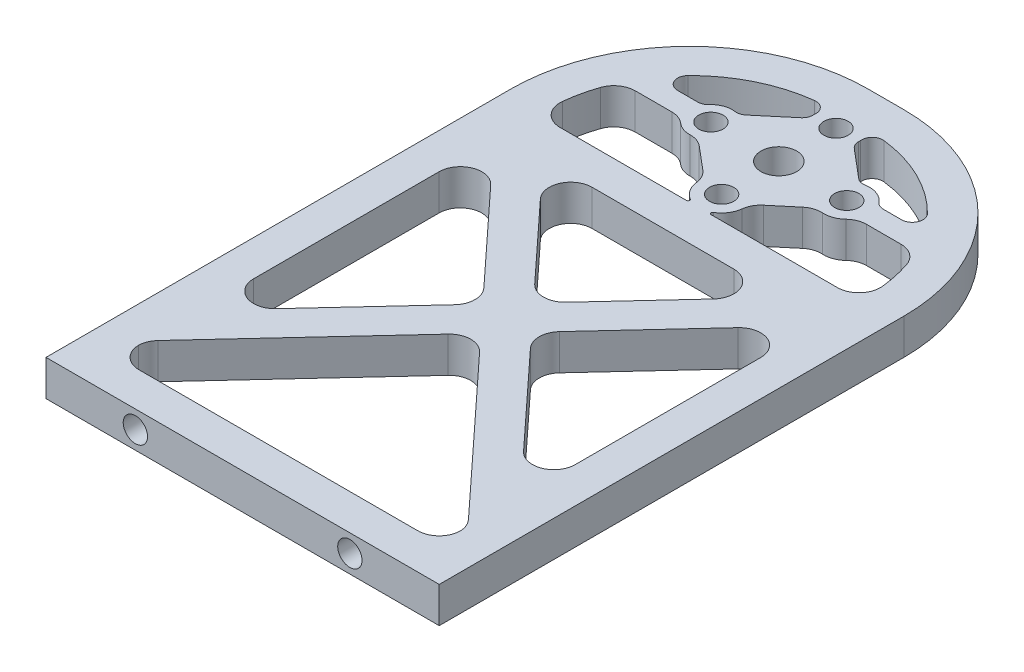
from build123d import *

# Parameters (mm, degrees)
SKETCH1_W           = 55.00000000000001
SKETCH1_H           = 90
BOSS_EXTRUDE1_DEPTH = 5
SKETCH2_R           = 2.499999999999999
SKETCH2_R_2         = 1.7000000000000015
CUT_EXTRUDE1_DEPTH  = 5
CUT_EXTRUDE2_DEPTH  = 5
SKETCH4_R           = 1.6999999999999995
CUT_EXTRUDE3_DEPTH  = 10
FILLET1_R           = 25
CUT_EXTRUDE4_DEPTH  = 5
FILLET2_R           = 3
FILLET3_R           = 1.5
FILLET4_DEPTH       = 5
FILLET5_DEPTH       = 5


with BuildPart() as part:
    # Sketch1 → Boss-Extrude1 (new body)
    with BuildSketch(Plane(origin=(0, 0, 0), x_dir=(1, 0, 0), z_dir=(0, 1, 0))):
        with Locations((27.500000000000004, 45)):
            Rectangle(SKETCH1_W, SKETCH1_H)
    extrude(amount=BOSS_EXTRUDE1_DEPTH)

    # Sketch2 → Cut-Extrude1 (cut)
    with BuildSketch(Plane(origin=(0, 5, 0), x_dir=(1, 0, 0), z_dir=(0, 1, 0))):
        with Locations(Location((27.5, 75, 0), (0, 0, 270))):
            Circle(SKETCH2_R)
        with Locations(Location((27.5, 83, 0), (0, 0, 270))):
            Circle(SKETCH2_R_2)
        with Locations(Location((27.5, 66.99999999999999, 0), (0, 0, 270))):
            Circle(SKETCH2_R_2)
        with Locations(Location((18.000000000000004, 75, 0), (0, 0, 270))):
            Circle(SKETCH2_R_2)
        with Locations(Location((37, 75, 0), (0, 0, 270))):
            Circle(SKETCH2_R_2)
    extrude(amount=-CUT_EXTRUDE1_DEPTH, mode=Mode.SUBTRACT)

    # Sketch3 → Cut-Extrude2 (cut)
    with BuildSketch(Plane(origin=(0, 5, 0), x_dir=(1, 0, 0), z_dir=(0, 1, 0))):
        with BuildLine():
            Line((10.000000000000012, 10), (15.00000000000001, 10.000000000000002))
            ThreePointArc((15.00000000000001, 10.000000000000002), (17.50000000000001, 7.500000000000004), (15.000000000000012, 5.000000000000005))
            Line((15.000000000000012, 5.000000000000005), (10.000000000000012, 5.000000000000004))
            ThreePointArc((10.000000000000012, 5.000000000000004), (7.500000000000015, 7.500000000000003), (10.000000000000012, 10))
        make_face()
        with BuildLine():
            Line((44.999999999999986, 10.000000000000055), (39.99999999999999, 10.000000000000057))
            ThreePointArc((39.99999999999999, 10.000000000000057), (37.499999999999986, 7.500000000000061), (39.999999999999986, 5.00000000000006))
            Line((39.999999999999986, 5.00000000000006), (44.999999999999986, 5.00000000000006))
            ThreePointArc((44.999999999999986, 5.00000000000006), (47.499999999999986, 7.500000000000058), (44.999999999999986, 10.000000000000055))
        make_face()
    extrude(amount=-CUT_EXTRUDE2_DEPTH, mode=Mode.SUBTRACT)

    # Sketch4 → Cut-Extrude3 (cut)
    with BuildSketch(Plane.XY):
        with Locations((12.5, 2.5)):
            Circle(SKETCH4_R)
        with Locations((42.49999999999999, 2.5)):
            Circle(SKETCH4_R)
    extrude(amount=-CUT_EXTRUDE3_DEPTH, mode=Mode.SUBTRACT)

    # Fillet1
    fillet1_edges = [part.edges().sort_by_distance(p)[0] for p in [
        (0, 2.5, -90),
        (55, 2.5, -90),
    ]]
    fillet(fillet1_edges, radius=FILLET1_R)

    # Sketch5 → Cut-Extrude4 (cut)
    with BuildSketch(Plane(origin=(0, 5, 0), x_dir=(1, 0, 0), z_dir=(0, 1, 0))):
        with BuildLine():
            ThreePointArc((30.000000000000004, 84.99999999999999), (30.616351748042604, 83.73372459579312), (30.629699199450542, 82.32547578178497))
            Line((30.629699199450524, 82.32547578178496), (35.80270803789781, 77.9692578125662))
            ThreePointArc((35.802708037897816, 77.96925781256621), (38.09764753434343, 78.00751889276688), (39.82842712474622, 76.49999999999993))
            Line((39.82842712474624, 76.49999999999999), (46.363068171954, 76.49999999999999))
            ThreePointArc((46.363068171953856, 76.49999999999959), (39.21954445729311, 82.74823934929873), (30.000000000000004, 84.99999999999999))
        make_face()
        with BuildLine():
            Line((19.021093968951536, 77.82088055517613), (24.370300800549494, 82.32547578178495))
            ThreePointArc((24.37030080054947, 82.32547578178496), (24.383648251957403, 83.7337245957931), (25.000000000000004, 84.99999999999999))
            ThreePointArc((25, 84.99999999999999), (15.780455542706903, 82.74823934929873), (8.636931828046162, 76.49999999999959))
            Line((8.63693182804602, 76.49999999999999), (15.40192378864667, 76.49999999999999))
            ThreePointArc((15.40192378864667, 76.49999999999997), (16.971457532003043, 77.81817323660678), (19.021093968951533, 77.82088055517613))
        make_face()
        with BuildLine():
            ThreePointArc((50, 64.99999999999997), (49.52021183036496, 69.35446094226141), (48.10386699023197, 73.49999999999936))
            Line((48.103866990232184, 73.50000000000001), (39.82842712474624, 73.50000000000001))
            ThreePointArc((39.82842712474622, 73.50000000000007), (38.09764753434344, 71.99248110723312), (35.80270803789783, 72.03074218743379))
            Line((35.80270803789782, 72.0307421874338), (30.629699199450528, 67.67452421821504))
            ThreePointArc((30.629699199450535, 67.67452421821503), (30.402791018509024, 65.64951701126475), (28.99999999999998, 64.1715728752538))
            Line((29.000000000000004, 64.17157287525379), (29.000000000000004, 63.79843788128356))
            Line((29.000000000000004, 63.79843788128356), (50, 63.79843788128356))
            Line((50, 63.79843788128356), (50, 64.99999999999997))
        make_face()
        with BuildLine():
            ThreePointArc((19.021093968951497, 72.17911944482385), (16.971457532003026, 72.18182676339323), (15.40192378864667, 73.50000000000003))
            Line((15.40192378864667, 73.50000000000001), (6.89613300976783, 73.50000000000001))
            ThreePointArc((6.89613300976804, 73.49999999999936), (5.479788169635057, 69.35446094226141), (5.000000000000007, 64.99999999999997))
            Line((5.000000000000004, 64.99999999999997), (5.000000000000004, 63.79843788128356))
            Line((5.000000000000004, 63.79843788128356), (26.000000000000004, 63.79843788128356))
            Line((26.000000000000004, 63.79843788128356), (26.000000000000004, 64.17157287525377))
            ThreePointArc((26.00000000000005, 64.17157287525379), (24.59720898149099, 65.64951701126472), (24.37030080054947, 67.67452421821501))
            Line((24.37030080054949, 67.67452421821503), (19.0210939689515, 72.17911944482385))
        make_face()
        Polygon((27.50000000000002, 40.67879140383743), (44.277961342029805, 58.798437881283576), (10.722038657970216, 58.79843788128357), align=None)
        Polygon((50, 16.37953135480838), (50, 57.61882430970066), (30.907153353376447, 36.999177832254524), align=None)
        Polygon((24.09284664662358, 36.999177832254496), (5.000000000000021, 57.61882430970065), (5.000000000000001, 16.379531354808364), align=None)
        Polygon((50, 5), (50, 9.020304211642536), (27.500000000000004, 33.3195642606716), (5.000000000000028, 9.020304211642582), (5, 5), align=None)
    extrude(amount=-CUT_EXTRUDE4_DEPTH, mode=Mode.SUBTRACT)

    # Fillet2
    # the kernel refuses this fillet: 3 mm, written as the material it adds along each edge
    with BuildSketch(Plane(origin=(30.62969919945053, 5, -67.67452421821503), x_dir=(0.7649111981170442, 0, -0.6441357457827876), z_dir=(0, -1, 0))) as fillet2_piece_1:
        with BuildLine():
            CenterArc((1.4388170342279112, 3), FILLET2_R, 226.52075102631792, 43.47924897368284)
            ThreePointArc((-0.6254584228035264, 0.823129117862604), (-0.2792858227831543, 0.43697667064582524), (0, 0))
            Line((0, 0), (1.4388170342279505, 4e-17))
        make_face()
    extrude(amount=5)
    with BuildSketch(Plane(origin=(35.80270803789783, 5, -72.03074218743379), x_dir=(0.9756512801214835, 0, 0.21932756232929423), z_dir=(0, -1, 0))) as fillet2_piece_2:
        with BuildLine():
            CenterArc((1.5181554182088943, 2.960641583195651), FILLET2_R, 217.22955187796006, 43.47924897368256)
            Line((-0.8704985020702118, 1.1456119831242833), (0, 0))
            ThreePointArc((0, 0), (0.5168993575467952, 0.04200280543114734), (1.0337987150935795, 0))
        make_face()
    extrude(amount=5)
    with BuildSketch(Plane(origin=(39.82842712474623, 5, -73.50000000000004), x_dir=(1, 0, 1.975e-14), z_dir=(0, -1, 0))) as fillet2_piece_3:
        with BuildLine():
            CenterArc((1.4388170342279547, 3), FILLET2_R, 226.5207510263163, 43.47924897368256)
            ThreePointArc((-0.6254584228035449, 0.8231291178626615), (-0.27928582278316433, 0.43697667064583906), (0, 0))
            Line((0, 0), (1.4388170342278954, 0))
        make_face()
    extrude(amount=5)
    with BuildSketch(Plane(origin=(48.10386699023208, 5, -73.49999999999969), x_dir=(-1, 0, -1.6195e-13), z_dir=(0, -1, 0))) as fillet2_piece_4:
        with BuildLine():
            CenterArc((2.018159048086173, -3), FILLET2_R, 89.99999999999072, 71.12349636944082)
            ThreePointArc((-0.8204952946452142, -2.0294117647054244), (-0.4380333665326992, -1.0034720596920297), (0, 0))
            Line((0, 0), (2.018159048086659, 0))
        make_face()
    extrude(amount=5)
    with BuildSketch(Plane(origin=(50, 5, -63.79843788128356), x_dir=(-1, 0, 0), z_dir=(0, -1, 0))) as fillet2_piece_5:
        with BuildLine():
            CenterArc((3.0953964498671382, 3), FILLET2_R, 173.9272895495291, 96.07271045047094)
            Line((0.11223111749075088, 3.317371390814756), (-0.18608541574688786, 3.3491085298962275))
            ThreePointArc((-0.18608541574688786, 3.3491085298962275), (-0.29999999999999716, 1.20156211871641), (-0.29999999999999716, 0))
            Line((-0.29999999999999716, 0), (0, -0.29999999999999716))
            Line((0, -0.29999999999999716), (3.0953964498671382, -0.29999999999999716))
            Line((3.0953964498671382, -0.29999999999999716), (3.0953964498671382, 0))
        make_face()
    extrude(amount=5)
    with BuildSketch(Plane(origin=(24.37030080054948, 5, -67.67452421821503), x_dir=(-0.76491119811705, 0, -0.6441357457827805), z_dir=(0, -1, 0))) as fillet2_piece_6:
        with BuildLine():
            CenterArc((1.4388170342279347, -3.0000000000000018), FILLET2_R, 89.99999999999983, 43.47924897368253)
            ThreePointArc((-0.6254584228035133, -0.8231291178626141), (-0.27928582278314756, -0.43697667064583), (0, 0))
            Line((0, 0), (1.4388170342279438, -1e-17))
        make_face()
    extrude(amount=5)
    with BuildSketch(Plane(origin=(19.021093968951497, 5, -72.17911944482385), x_dir=(0.7649111981170513, 0, 0.644135745782779), z_dir=(0, -1, 0))) as fillet2_piece_7:
        with BuildLine():
            CenterArc((1.3705507552437566, 3.0000000000000018), FILLET2_R, 228.59037789072798, 41.409622109271936)
            ThreePointArc((-0.6137627280547322, 0.7500000000000423), (-0.27639603776938276, 0.39994767601300885), (0, 0))
            Line((0, 0), (1.3705507552437535, -3e-17))
        make_face()
    extrude(amount=5)
    with BuildSketch(Plane(origin=(15.401923788646672, 5, -73.50000000000003), x_dir=(0.6333158920043296, 0, 0.7738933911946531), z_dir=(0, -1, 0))) as fillet2_piece_8:
        with BuildLine():
            CenterArc((1.4536885994895705, 2.96060784779286), FILLET2_R, 219.29518894536204, 41.409622109273414)
            Line((-0.8679915740944324, 1.0606601717799247), (0, 0))
            ThreePointArc((0, 0), (0.4845628664965213, 0.03939215220713661), (0.9691257329930376, -6e-17))
        make_face()
    extrude(amount=5)
    with BuildSketch(Plane(origin=(6.896133009767933, 5, -73.49999999999969), x_dir=(1, 0, -1.6195e-13), z_dir=(0, -1, 0))) as fillet2_piece_9:
        with BuildLine():
            CenterArc((2.0181590480861766, 3), FILLET2_R, 198.87650363056818, 71.12349636944111)
            ThreePointArc((-0.8204952946452142, 2.0294117647054386), (-0.43803336653269564, 1.0034720596920155), (0, 0))
            Line((0, 0), (2.0181590480866625, 0))
        make_face()
    extrude(amount=5)
    with BuildSketch(Plane(origin=(5.000000000000004, 5, -63.79843788128356), x_dir=(0.03381199502885917, 0, -0.9994282110247681), z_dir=(0, -1, 0))) as fillet2_piece_10:
        with BuildLine():
            CenterArc((3.1029461624495607, 2.9921905512165696), FILLET2_R, 178.06234606412994, 96.0727104504706)
            Line((0.10466152937525638, 3.0936265363031437), (-0.1951669339321712, 3.103770134811801))
            Line((-0.1951669339321712, 3.103770134811801), (-0.2998284633074276, 0.01014359850865765))
            Line((-0.2998284633074276, 0.01014359850865765), (-0.01014359850865774, -0.29982846330743024))
            ThreePointArc((-0.01014359850865774, -0.29982846330743024), (1.190731480235214, -0.3404556756923323), (3.340901627409787, -0.299219055121657))
            Line((3.340901627409787, -0.299219055121657), (3.3192693124134056, 0))
        make_face()
    extrude(amount=5)
    with BuildSketch(Plane(origin=(50, 5, -5), x_dir=(0, 0, -1), z_dir=(0, -1, 0))) as fillet2_piece_11:
        with BuildLine():
            CenterArc((FILLET2_R, -FILLET2_R), FILLET2_R, 90, 90)
            Line((0, -FILLET2_R), (0, 0))
            Line((0, 0), (FILLET2_R, 0))
        make_face()
    extrude(amount=5)
    with BuildSketch(Plane(origin=(50, 5, -9.020304211642536), x_dir=(0, 0, 1), z_dir=(0, -1, 0))) as fillet2_piece_12:
        with BuildLine():
            CenterArc((FILLET2_R * 0.391878315343, FILLET2_R), FILLET2_R, 227.20172837753046, 42.79827162246954)
            Line((-FILLET2_R * 0.287540855003, FILLET2_R * 0.266249639887), (0, 0))
            Line((0, 0), (FILLET2_R * 0.391878315343, 0))
        make_face()
    extrude(amount=5)
    with BuildSketch(Plane(origin=(5, 5, -5), x_dir=(0, 0, -1), z_dir=(0, -1, 0))) as fillet2_piece_13:
        with BuildLine():
            CenterArc((FILLET2_R, FILLET2_R), FILLET2_R, 180, 90)
            Line((0, FILLET2_R), (0, 0))
            Line((0, 0), (FILLET2_R, 0))
        make_face()
    extrude(amount=5)
    with BuildSketch(Plane(origin=(5.000000000000014, 5, -9.020304211642575), x_dir=(0.6794191703463476, 0, -0.7337503601129478), z_dir=(0, -1, 0))) as fillet2_piece_14:
        with BuildLine():
            CenterArc((FILLET2_R * 0.391878315343, FILLET2_R), FILLET2_R, 227.20172837753026, 42.798271622469485)
            Line((-FILLET2_R * 0.287540855003, FILLET2_R * 0.266249639887), (0, 0))
            Line((0, 0), (FILLET2_R * 0.391878315343, -2e-17))
        make_face()
    extrude(amount=5)
    with BuildSketch(Plane(origin=(27.500000000000007, 5, -33.319564260671605), x_dir=(0.6794191703463425, 0, 0.7337503601129526), z_dir=(0, -1, 0))) as fillet2_piece_15:
        with BuildLine():
            CenterArc((FILLET2_R * 1.07996711329, FILLET2_R), FILLET2_R, 175.59654324493897, 94.40345675506092)
            Line((FILLET2_R * 0.0829189914716, FILLET2_R * 1.07677918193), (0, 0))
            Line((0, 0), (FILLET2_R * 1.07996711329, -2e-17))
        make_face()
    extrude(amount=5)
    with BuildSketch(Plane(origin=(5.000000000000011, 5, -16.379531354808368), x_dir=(-1.16e-15, 0, -1), z_dir=(0, -1, 0))) as fillet2_piece_16:
        with BuildLine():
            CenterArc((FILLET2_R * 2.55181254192, FILLET2_R), FILLET2_R, 132.79827162246937, 137.20172837753069)
            Line((FILLET2_R * 1.87239337158, FILLET2_R * 1.73375036011), (0, 0))
            Line((0, 0), (FILLET2_R * 2.55181254192, 0))
        make_face()
    extrude(amount=5)
    with BuildSketch(Plane(origin=(50, 5, -16.37953135480838), x_dir=(0, 0, -1), z_dir=(0, -1, 0))) as fillet2_piece_17:
        with BuildLine():
            CenterArc((FILLET2_R * 2.55181254192, -FILLET2_R), FILLET2_R, 90, 137.20172837753046)
            Line((FILLET2_R * 1.87239337158, -FILLET2_R * 1.73375036011), (0, 0))
            Line((0, 0), (FILLET2_R * 2.55181254192, 0))
        make_face()
    extrude(amount=5)
    with BuildSketch(Plane(origin=(30.907153353376444, 5, -36.99917783225452), x_dir=(0.6794191703463437, 0, -0.7337503601129515), z_dir=(0, -1, 0))) as fillet2_piece_18:
        with BuildLine():
            CenterArc((FILLET2_R * 0.925954121838, FILLET2_R), FILLET2_R, 184.40345675506106, 85.59654324493908)
            Line((-FILLET2_R * 0.071093999981, FILLET2_R * 0.923220818068), (0, 0))
            Line((0, 0), (FILLET2_R * 0.925954121838, 4e-17))
        make_face()
    extrude(amount=5)
    with BuildSketch(Plane(origin=(50, 5, -57.61882430970066), x_dir=(0, 0, 1), z_dir=(0, -1, 0))) as fillet2_piece_19:
        with BuildLine():
            CenterArc((FILLET2_R * 2.55181254192, FILLET2_R), FILLET2_R, 132.79827162246934, 137.20172837753066)
            Line((FILLET2_R * 1.87239337158, FILLET2_R * 1.73375036011), (0, 0))
            Line((0, 0), (FILLET2_R * 2.55181254192, 0))
        make_face()
    extrude(amount=5)
    with BuildSketch(Plane(origin=(24.092846646623578, 5, -36.9991778322545), x_dir=(-0.6794191703463445, 0, -0.7337503601129507), z_dir=(0, -1, 0))) as fillet2_piece_20:
        with BuildLine():
            CenterArc((FILLET2_R * 0.925954121838, -FILLET2_R), FILLET2_R, 90, 85.5965432449388)
            Line((-FILLET2_R * 0.071093999981, -FILLET2_R * 0.923220818068), (0, 0))
            Line((0, 0), (FILLET2_R * 0.925954121838, 1.5e-16))
        make_face()
    extrude(amount=5)
    with BuildSketch(Plane(origin=(5.000000000000012, 5, -57.618824309700656), x_dir=(0.6794191703463444, 0, 0.7337503601129509), z_dir=(0, -1, 0))) as fillet2_piece_21:
        with BuildLine():
            CenterArc((FILLET2_R * 2.55181254192, FILLET2_R), FILLET2_R, 132.79827162246934, 137.2017283775306)
            Line((FILLET2_R * 1.87239337158, FILLET2_R * 1.73375036011), (0, 0))
            Line((0, 0), (FILLET2_R * 2.55181254192, 7e-17))
        make_face()
    extrude(amount=5)
    with BuildSketch(Plane(origin=(27.500000000000014, 5, -40.67879140383742), x_dir=(-0.6794191703463448, 0, -0.7337503601129505), z_dir=(0, -1, 0))) as fillet2_piece_22:
        with BuildLine():
            CenterArc((FILLET2_R * 1.07996711329, FILLET2_R), FILLET2_R, 175.59654324493903, 94.40345675506097)
            Line((FILLET2_R * 0.0829189914716, FILLET2_R * 1.07677918193), (0, 0))
            Line((0, 0), (FILLET2_R * 1.07996711329, 0))
        make_face()
    extrude(amount=5)
    with BuildSketch(Plane(origin=(44.277961342029805, 5, -58.798437881283576), x_dir=(-1, 0, 0), z_dir=(0, -1, 0))) as fillet2_piece_23:
        with BuildLine():
            CenterArc((FILLET2_R * 2.28881546319, -FILLET2_R), FILLET2_R, 90, 132.79827162246954)
            Line((FILLET2_R * 1.55506510308, -FILLET2_R * 1.67941917035), (0, 0))
            Line((0, 0), (FILLET2_R * 2.28881546319, 0))
        make_face()
    extrude(amount=5)
    with BuildSketch(Plane(origin=(10.722038657970216, 5, -58.79843788128357), x_dir=(1, 0, 0), z_dir=(0, -1, 0))) as fillet2_piece_24:
        with BuildLine():
            CenterArc((FILLET2_R * 2.28881546319, FILLET2_R), FILLET2_R, 137.20172837753069, 132.79827162246931)
            Line((FILLET2_R * 1.55506510308, FILLET2_R * 1.67941917035), (0, 0))
            Line((0, 0), (FILLET2_R * 2.28881546319, 0))
        make_face()
    extrude(amount=5)

    # Fillet3
    fillet3_edges = [part.edges().sort_by_distance(p)[0] for p in [
        (19.021093968951533, 2.5, -77.82088055517613),
        (15.40192378864667, 2.5, -76.49999999999997),
        (8.636931828046091, 2.5, -76.49999999999979),
        (25, 2.5, -84.99999999999999),
        (24.37030080054948, 2.5, -82.32547578178495),
        (46.36306817195393, 2.5, -76.49999999999979),
        (39.82842712474623, 2.5, -76.49999999999996),
        (35.802708037897816, 2.5, -77.96925781256621),
        (30.629699199450535, 2.5, -82.32547578178497),
        (30.000000000000004, 2.5, -84.99999999999999),
    ]]
    fillet(fillet3_edges, radius=FILLET3_R)

    # Fillet4: read off the stored shape, not the designer's step
    # Fillet4 outline → Fillet4 (add)
    with BuildSketch(Plane(origin=(0, 0, 0), x_dir=(1, 0, 0), z_dir=(0, 1, 0))):
        with BuildLine():
            ThreePointArc((26, 64.171572875), (25.941465448, 64.20340027), (25.883605898, 64.236438872))
            add(Edge.make_bspline(
                [(25.883605898, 64.236438872), (25.951299470855144, 64.19684521503525), (25.999999993754294, 64.12576050726905), (26, 64.033518938)],
                knots=[0, 0, 0, 0, 0.41302494895751024, 0.41302494895751024, 0.41302494895751024, 0.41302494895751024], degree=3, weights=[1, 0.7966656383445988, 0.6773134410332275, 0.6419434080658863]))
            Line((26, 64.033518938), (26, 64.171572875))
        make_face()
        with BuildLine():
            Line((26, 63.798437881), (26, 64.033518938))
            add(Edge.make_bspline(
                [(26, 64.033518938), (26.000000010159642, 63.88345541796652), (25.88979305843695, 63.79843788128297), (25.764918959, 63.798437881)],
                knots=[0.41302494895751024, 0.41302494895751024, 0.41302494895751024, 0.41302494895751024, 1, 1, 1, 1], degree=3, weights=[0.6419434080658863, 0.591676887946988, 0.7110290852583592, 1]))
            Line((25.764918959, 63.798437881), (26, 63.798437881))
        make_face()
    extrude(amount=FILLET4_DEPTH)

    # Fillet5: read off the stored shape, not the designer's step
    # Fillet5 outline → Fillet5 (add)
    with BuildSketch(Plane(origin=(0, 0, 0), x_dir=(1, 0, 0), z_dir=(0, 1, 0))):
        with BuildLine():
            Line((29, 63.798437881), (29.235081041, 63.798437881))
            add(Edge.make_bspline(
                [(29.235081041, 63.798437881), (29.110206941564474, 63.79843788128234), (28.99999998984096, 63.88345541796577), (29, 64.033518938)],
                knots=[0, 0, 0, 0, 0.5869750510425621, 0.5869750510425621, 0.5869750510425621, 0.5869750510425621], degree=3, weights=[1, 0.7110290852572407, 0.5916768879454284, 0.6419434080645631]))
            Line((29, 64.033518938), (29, 63.798437881))
        make_face()
        with BuildLine():
            Line((29, 64.171572875), (29, 64.033518938))
            add(Edge.make_bspline(
                [(29, 64.033518938), (29.000000006246133, 64.12576050726932), (29.048700529145503, 64.19684521503576), (29.116394102, 64.236438872)],
                knots=[0.5869750510425621, 0.5869750510425621, 0.5869750510425621, 0.5869750510425621, 1, 1, 1, 1], degree=3, weights=[0.6419434080645631, 0.67731344103206, 0.7966656383438724, 1]))
            ThreePointArc((29.116394102, 64.236438872), (29.058534552, 64.20340027), (29, 64.171572875))
        make_face()
    extrude(amount=FILLET5_DEPTH)


solid = part.part
